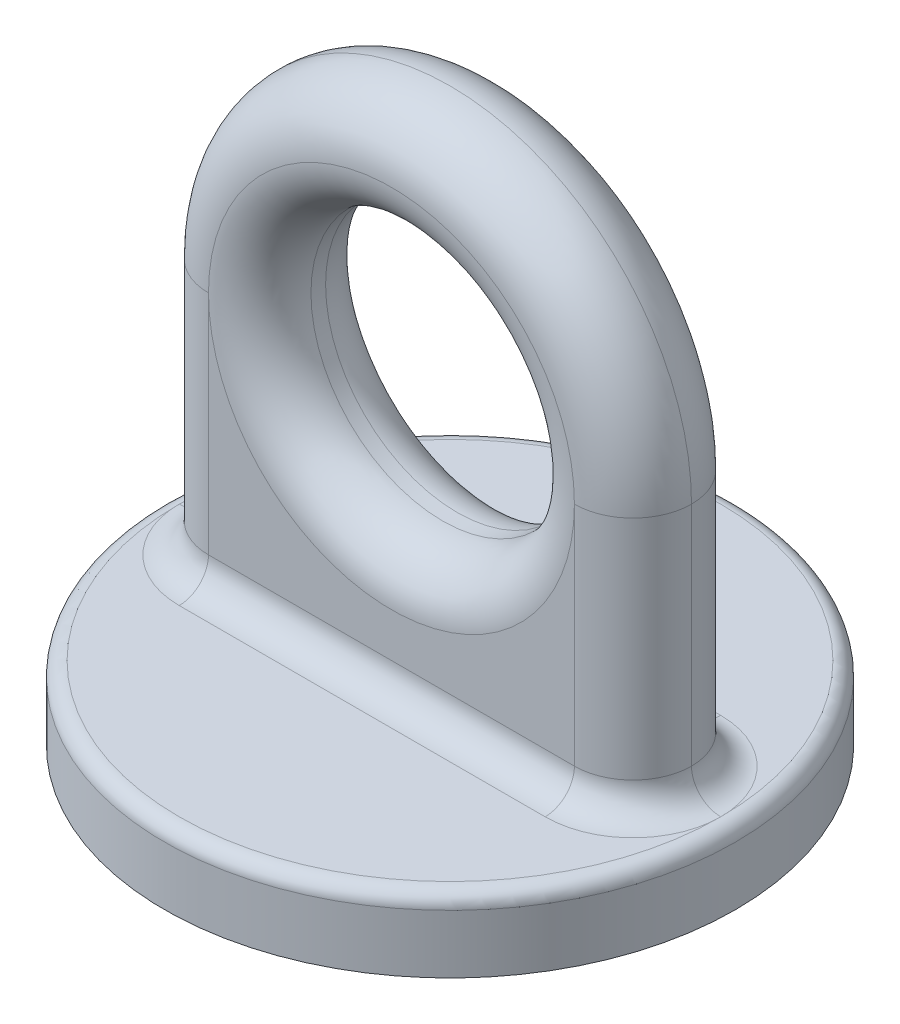
from build123d import *

# Parameters (mm, degrees)
SKETCH2_W                          = 24.765
SKETCH2_H                          = 6.35
EXTRUDED_VERTICAL_PLATE_DEPTH      = 5.08
EXTRUDED_VERTICAL_PLATE_DEPTH_BACK = 5.08
F_0_9D_EYE_HOLE_D                  = 22.86
EDGE_FILLET_R                      = 5.08
CONNECTING_FILLET_R                = 2.54
BASE_FILLET_R                      = 1.27
F_0_325D_BOTTOM_HOLE_D             = 8.255
F_0_325D_BOTTOM_HOLE_DEPTH         = 12.7
EYE_FILLET_R                       = 4.445
F_0_325D_BOTTOM_HOLE_THREAD_PITCH  = 1.5875


with BuildPart() as part:
    # Sketch2 → Revolved Base (revolve)
    with BuildSketch(Plane.XY):
        with Locations((-12.3825, 3.175)):
            Rectangle(SKETCH2_W, SKETCH2_H)
    revolve(axis=Axis((0, 6.35, 0), (0, -1, 0)))

    # Sketch3 → Extruded Vertical Plate (add, two sides: drawn at the far end of the back side and taken through both)
    with BuildSketch(Plane.XY.offset(-EXTRUDED_VERTICAL_PLATE_DEPTH_BACK)):
        with BuildLine():
            Line((-20.955, 6.35), (20.955, 6.35))
            Line((20.955, 6.35), (20.955, 28.575))
            ThreePointArc((20.955, 28.575), (0, 49.53), (-20.955, 28.575))
            Line((-20.955, 28.575), (-20.955, 6.35))
        make_face()
    extrude(amount=EXTRUDED_VERTICAL_PLATE_DEPTH + EXTRUDED_VERTICAL_PLATE_DEPTH_BACK)

    # 0.9D Eye Hole (through all)
    with Locations(Plane.XY.offset(5.08)):
        with Locations((0, 28.575)):
            Hole(F_0_9D_EYE_HOLE_D / 2)

    # Edge Fillet
    edge_fillet_edges = [part.edges().sort_by_distance(p)[0] for p in [
        (20.955, 17.4625, -5.08),
        (-20.955, 17.4625, -5.08),
        (20.955, 17.4625, 5.08),
        (-20.955, 17.4625, 5.08),
        (0, 49.53, -5.08),
        (0, 49.53, 5.08),
    ]]
    fillet(edge_fillet_edges, radius=EDGE_FILLET_R - 0.0001)  # a hair under: the kernel refuses the full size

    # Connecting Fillet
    connecting_fillet_edges = [part.edges().sort_by_distance(p)[0] for p in [
        (0, 6.35, -5.08),
        (0, 6.35, 5.08),
        (19.467131738, 6.35, -3.592131738),
        (-19.467131738, 6.35, -3.592131738),
        (19.467131738, 6.35, 3.592131738),
        (-19.467131738, 6.35, 3.592131738),
    ]]
    fillet(connecting_fillet_edges, radius=CONNECTING_FILLET_R)

    # Base Fillet
    base_fillet_edges = [part.edges().sort_by_distance(p)[0] for p in [
        (24.765, 6.35, 0),
    ]]
    fillet(base_fillet_edges, radius=BASE_FILLET_R - 0.0001)  # a hair under: the kernel refuses the full size

    # Sketch8 → Under Base Revolved Cut (revolve, cut)
    with BuildSketch(Plane.XY):
        Polygon((-22.225, 0), (-21.59, 3.683), (-7.62, 3.683), (-6.35, 0), align=None)
    revolve(axis=Axis((0, 0, 0), (0, 1, 0)), mode=Mode.SUBTRACT)

    # 0.325D Bottom Hole
    with Locations(Plane(origin=(0, 0, 0), x_dir=(-1, 0, 0), z_dir=(0, -1, 0))):
        with Locations((0, 0)):
            Hole(F_0_325D_BOTTOM_HOLE_D / 2, depth=F_0_325D_BOTTOM_HOLE_DEPTH)

    # Eye Fillet
    eye_fillet_edges = [part.edges().sort_by_distance(p)[0] for p in [
        (11.43, 28.575, -5.08),
        (11.43, 28.575, 5.08),
    ]]
    fillet(eye_fillet_edges, radius=EYE_FILLET_R)

    # 0.325D Bottom Hole Thread: the profile of Thread Profile1 profile screwed along a right-hand helix of 8 turns, 8 arcs to a turn; built about Z, then put on its axis
    f_0_325d_bottom_hole_thread_z = Axis((0, 0, 0), (0, 0, 1))
    f_0_325d_bottom_hole_thread_corners = [(4.1272, 0, -0.000173205), (4.986759577, 0, 0.496093748), (4.986759577, 0, 0.694531248), (4.1272, 0, 1.190798201)]
    with BuildLine(mode=Mode.PRIVATE) as f_0_325d_bottom_hole_thread_profile:
        Line(f_0_325d_bottom_hole_thread_corners[0], f_0_325d_bottom_hole_thread_corners[1])
        Line(f_0_325d_bottom_hole_thread_corners[1], f_0_325d_bottom_hole_thread_corners[2])
        Line(f_0_325d_bottom_hole_thread_corners[2], f_0_325d_bottom_hole_thread_corners[3])
        Line(f_0_325d_bottom_hole_thread_corners[3], f_0_325d_bottom_hole_thread_corners[0])
    f_0_325d_bottom_hole_thread_cap = Face(f_0_325d_bottom_hole_thread_profile.wire())
    f_0_325d_bottom_hole_thread_turn_angles = [0, 22.5, 45, 67.5, 90, 112.5, 135, 157.5, 180, 202.5, 225, 247.5, 270, 292.5, 315, 337.5, 360]
    f_0_325d_bottom_hole_thread_turn_weights = [1, 0.9238795325112867, 1, 0.9238795325112867, 1, 0.9238795325112867, 1, 0.9238795325112867, 1, 0.9238795325112867, 1, 0.9238795325112867, 1, 0.9238795325112867, 1, 0.9238795325112867, 1]
    f_0_325d_bottom_hole_thread_turn_rails = [Edge.make_bspline([Vector(p[0], p[1], 0).rotate(f_0_325d_bottom_hole_thread_z, f_0_325d_bottom_hole_thread_turn_angles[k]) / f_0_325d_bottom_hole_thread_turn_weights[k] + Vector(0, 0, p[2] + F_0_325D_BOTTOM_HOLE_THREAD_PITCH * f_0_325d_bottom_hole_thread_turn_angles[k] / 360) for k in range(17)], [0, 0, 0, 1, 1, 2, 2, 3, 3, 4, 4, 5, 5, 6, 6, 7, 7, 8, 8, 8], 2, f_0_325d_bottom_hole_thread_turn_weights) for p in f_0_325d_bottom_hole_thread_corners]
    f_0_325d_bottom_hole_thread_turn_sides = [Face.make_surface_from_curves(f_0_325d_bottom_hole_thread_turn_rails[p[0]], f_0_325d_bottom_hole_thread_turn_rails[p[1]]) for p in [(0, 1), (1, 2), (2, 3), (3, 0)]]
    f_0_325d_bottom_hole_thread = Plane(origin=(0, 12.7, 0), x_dir=(-1, 0, 0), z_dir=(0, -1, 0)) * Solid(Shell([*[p.moved(Location((0, 0, F_0_325D_BOTTOM_HOLE_THREAD_PITCH * i))) for i in range(8) for p in f_0_325d_bottom_hole_thread_turn_sides], f_0_325d_bottom_hole_thread_cap, f_0_325d_bottom_hole_thread_cap.rotate(f_0_325d_bottom_hole_thread_z, 2880).moved(Location((0, 0, F_0_325D_BOTTOM_HOLE_THREAD_PITCH * 2880 / 360)))]))
    add(f_0_325d_bottom_hole_thread, mode=Mode.SUBTRACT)


solid = part.part
